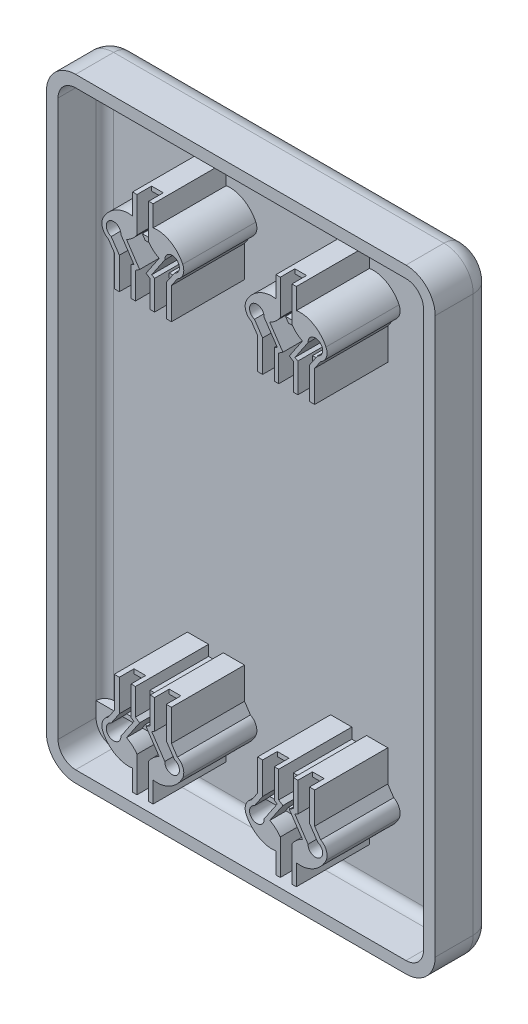
from build123d import *

# Parameters (mm, degrees)
SALIENTE_EXTRUIR1_DEPTH    = 20
REDONDEO1_R                = 7
VACIADO1_T                 = -4
CORTAR_EXTRUIR5_DEPTH      = 158.172679171
CORTAR_EXTRUIR5_DEPTH_BACK = 158.172679171
CROQUIS4_R                 = 1.6
CROQUIS4_19_R              = 3.5
CROQUIS4_19_R_2            = 1.6
CORTAR_EXTRUIR6_DEPTH      = 3
SALIENTE_EXTRUIR14_START   = 4
CROQUIS4_21_R              = 3.5
CROQUIS4_21_R_2            = 1.6
SALIENTE_EXTRUIR14_DEPTH   = 3
GUIA_START                 = 4
GUIA_CONTACTOS_DEPTH       = 25
ELEVADORES_START           = 4
CROQUIS5_23_W              = 4
CROQUIS5_23_H              = 1.504819616
CROQUIS5_23_W_2            = 5.046643545
CROQUIS5_23_H_2            = 1.498860913
CROQUIS5_23_H_3            = 1.502394155
CROQUIS5_23_H_4            = 1.495870233
CROQUIS5_23_H_5            = 1.495870234
CROQUIS5_23_H_6            = 1.502394154
CROQUIS5_23_H_7            = 1.498860914
ELEVADORES_DEPTH           = 20


with BuildPart() as part:
    # Croquis1 → Saliente-Extruir1 (new body)
    with BuildSketch(Plane.XY):
        with BuildLine():
            Line((-97.316636852, 96.923076923), (15.683363148, 96.923076923))
            ThreePointArc((15.683363148, 96.923076923), (22.75443096, 93.994144735), (25.683363148, 86.923076923))
            Line((25.683363148, 86.923076923), (25.683363148, -103.076923077))
            ThreePointArc((25.683363148, -103.076923077), (22.75443096, -110.147990889), (15.683363148, -113.076923077))
            Line((15.683363148, -113.076923077), (-97.316636852, -113.076923077))
            ThreePointArc((-97.316636852, -113.076923077), (-104.387704663, -110.147990889), (-107.316636852, -103.076923077))
            Line((-107.316636852, -103.076923077), (-107.316636852, 86.923076923))
            ThreePointArc((-107.316636852, 86.923076923), (-104.387704663, 93.994144735), (-97.316636852, 96.923076923))
        make_face()
    extrude(amount=SALIENTE_EXTRUIR1_DEPTH)

    # Redondeo1
    redondeo1_edges = [part.edges().sort_by_distance(p)[0] for p in [
        (-107.316636852, -8.076923077, 0),
        (-104.387704663, 93.994144735, 0),
        (-40.816636852, 96.923076923, 0),
        (22.75443096, 93.994144735, 0),
        (25.683363148, -8.076923077, 0),
        (22.75443096, -110.147990889, 0),
        (-40.816636852, -113.076923077, 0),
        (-104.387704663, -110.147990889, 0),
    ]]
    fillet(redondeo1_edges, radius=REDONDEO1_R)

    # Vaciado1
    vaciado1_openings = [part.faces().sort_by_distance(p)[0] for p in [
        (-40.816636852, -8.076923077, 20),
    ]]
    offset(amount=VACIADO1_T, openings=vaciado1_openings, kind=Kind.INTERSECTION)

    # Croquis4 (on Front Plane) → Cortar-Extruir5 (cut, two sides: drawn at the far end of the back side and taken through both)
    with BuildSketch(Plane.XY.offset(-CORTAR_EXTRUIR5_DEPTH_BACK)):
        with Locations(Location((-95.816636852, 85.423076923, 0), (0, 0, 180))):
            Circle(CROQUIS4_R)
        with Locations(Location((14.183363148, 85.423076923, 0), (0, 0, 180))):
            Circle(CROQUIS4_R)
        with Locations(Location((-95.816636852, -101.576923077, 0), (0, 0, 180))):
            Circle(CROQUIS4_R)
        with Locations(Location((14.183363148, -101.576923077, 0), (0, 0, 180))):
            Circle(CROQUIS4_R)
    extrude(amount=CORTAR_EXTRUIR5_DEPTH + CORTAR_EXTRUIR5_DEPTH_BACK, mode=Mode.SUBTRACT)

    # Croquis4<19> (on Front Plane) → Cortar-Extruir6 (cut)
    # profile 1 of 4: a face of its own
    with BuildSketch(Plane.XY):
        with Locations(Location((-95.816636852, 85.423076923, 0), (0, 0, 180))):
            Circle(CROQUIS4_19_R)
        with Locations(Location((-95.816636852, 85.423076923, 0), (0, 0, 180))):
            Circle(CROQUIS4_19_R_2, mode=Mode.SUBTRACT)
    # profile 2 of 4: a face of its own
    with BuildSketch(Plane.XY):
        with Locations(Location((14.183363148, 85.423076923, 0), (0, 0, 180))):
            Circle(CROQUIS4_19_R)
        with Locations(Location((14.183363148, 85.423076923, 0), (0, 0, 180))):
            Circle(CROQUIS4_19_R_2, mode=Mode.SUBTRACT)
    # profile 3 of 4: a face of its own
    with BuildSketch(Plane.XY):
        with Locations(Location((-95.816636852, -101.576923077, 0), (0, 0, 180))):
            Circle(CROQUIS4_19_R)
        with Locations(Location((-95.816636852, -101.576923077, 0), (0, 0, 180))):
            Circle(CROQUIS4_19_R_2, mode=Mode.SUBTRACT)
    # profile 4 of 4: a face of its own
    with BuildSketch(Plane.XY):
        with Locations(Location((14.183363148, -101.576923077, 0), (0, 0, 180))):
            Circle(CROQUIS4_19_R)
        with Locations(Location((14.183363148, -101.576923077, 0), (0, 0, 180))):
            Circle(CROQUIS4_19_R_2, mode=Mode.SUBTRACT)
    extrude(amount=CORTAR_EXTRUIR6_DEPTH, mode=Mode.SUBTRACT)

    # Croquis4<21> (on Front Plane) → Saliente-Extruir14 (add)
    # profile 1 of 8: a face of its own
    with BuildSketch(Plane.XY.offset(SALIENTE_EXTRUIR14_START)):
        with BuildLine():
            Line((-92.316636852, -109.076923077), (-92.316636852, -101.576923077))
            ThreePointArc((-92.316636852, -101.576923077), (-98.291510586, -104.051796811), (-95.816636852, -98.076923077))
            Line((-95.816636852, -98.076923077), (-103.316636852, -98.076923077))
            ThreePointArc((-103.316636852, -98.076923077), (-101.668986807, -107.429273032), (-92.316636852, -109.076923077))
        make_face()
    # profile 2 of 8: a face of its own
    with BuildSketch(Plane.XY.offset(SALIENTE_EXTRUIR14_START)):
        with Locations(Location((-95.816636852, -101.576923077, 0), (0, 0, 180))):
            Circle(CROQUIS4_21_R)
        with Locations(Location((-95.816636852, -101.576923077, 0), (0, 0, 180))):
            Circle(CROQUIS4_21_R_2, mode=Mode.SUBTRACT)
    # profile 3 of 8: a face of its own
    with BuildSketch(Plane.XY.offset(SALIENTE_EXTRUIR14_START)):
        with Locations(Location((14.183363148, -101.576923077, 0), (0, 0, 180))):
            Circle(CROQUIS4_21_R)
        with Locations(Location((14.183363148, -101.576923077, 0), (0, 0, 180))):
            Circle(CROQUIS4_21_R_2, mode=Mode.SUBTRACT)
    # profile 4 of 8: a face of its own
    with BuildSketch(Plane.XY.offset(SALIENTE_EXTRUIR14_START)):
        with BuildLine():
            ThreePointArc((17.683363148, -101.576923077), (14.183363148, -105.076923077), (10.683363148, -101.576923077))
            Line((10.683363148, -101.576923077), (10.683363148, -109.076923077))
            ThreePointArc((10.683363148, -109.076923077), (20.035713104, -107.429273032), (21.683363148, -98.076923077))
            Line((21.683363148, -98.076923077), (14.183363148, -98.076923077))
            ThreePointArc((14.183363148, -98.076923077), (16.658236883, -99.102049343), (17.683363148, -101.576923077))
        make_face()
    # profile 5 of 8: a face of its own
    with BuildSketch(Plane.XY.offset(SALIENTE_EXTRUIR14_START)):
        with BuildLine():
            ThreePointArc((17.683363148, 85.423076923), (16.658236883, 82.948203189), (14.183363148, 81.923076923))
            Line((14.183363148, 81.923076923), (21.683363148, 81.923076923))
            ThreePointArc((21.683363148, 81.923076923), (20.035713104, 91.275426878), (10.683363148, 92.923076923))
            Line((10.683363148, 92.923076923), (10.683363148, 85.423076923))
            ThreePointArc((10.683363148, 85.423076923), (14.183363148, 88.923076923), (17.683363148, 85.423076923))
        make_face()
    # profile 6 of 8: a face of its own
    with BuildSketch(Plane.XY.offset(SALIENTE_EXTRUIR14_START)):
        with BuildLine():
            Line((-103.316636852, 81.923076923), (-95.816636852, 81.923076923))
            ThreePointArc((-95.816636852, 81.923076923), (-98.291510586, 87.897950657), (-92.316636852, 85.423076923))
            Line((-92.316636852, 85.423076923), (-92.316636852, 92.923076923))
            ThreePointArc((-92.316636852, 92.923076923), (-101.668986807, 91.275426878), (-103.316636852, 81.923076923))
        make_face()
    # profile 7 of 8: a face of its own
    with BuildSketch(Plane.XY.offset(SALIENTE_EXTRUIR14_START)):
        with Locations(Location((-95.816636852, 85.423076923, 0), (0, 0, 180))):
            Circle(CROQUIS4_21_R)
        with Locations(Location((-95.816636852, 85.423076923, 0), (0, 0, 180))):
            Circle(CROQUIS4_21_R_2, mode=Mode.SUBTRACT)
    # profile 8 of 8: a face of its own
    with BuildSketch(Plane.XY.offset(SALIENTE_EXTRUIR14_START)):
        with Locations(Location((14.183363148, 85.423076923, 0), (0, 0, 180))):
            Circle(CROQUIS4_21_R)
        with Locations(Location((14.183363148, 85.423076923, 0), (0, 0, 180))):
            Circle(CROQUIS4_21_R_2, mode=Mode.SUBTRACT)
    extrude(amount=SALIENTE_EXTRUIR14_DEPTH)

    # Croquis5 → Guia contactos (add)
    with BuildSketch(Plane.XY.offset(GUIA_START)):
        with BuildLine():
            Line((-73.339958624, 59.826171884), (-76.135923142, 63.971359747))
            ThreePointArc((-76.135923142, 63.971359747), (-76.71461881, 68.405894657), (-72.819772852, 66.208131361))
            Line((-72.819772852, 66.208131361), (-68.346229624, 59.57583078))
            Line((-68.346229624, 59.57583078), (-69.339958624, 59.012970877))
            Line((-69.339958624, 59.012970877), (-69.339958624, 49.012651477))
            Line((-69.339958624, 49.012651477), (-67.839958624, 49.012651477))
            Line((-67.839958624, 49.012651477), (-67.839958624, 58.107987958))
            Line((-67.839958624, 58.107987958), (-66.416302227, 59.068256324))
            Line((-66.416302227, 59.068256324), (-70.898924286, 65.714016825))
            add(Edge.make_bspline(
                [(-67.316636852, 68.833301171), (-68.69376814, 66.819481242), (-70.898924286, 65.714016825)],
                knots=[0, 0, 0, 1, 1, 1], degree=2))
            Line((-67.316636852, 68.833301171), (-67.316636852, 80.83350237))
            Line((-67.316636852, 80.83350237), (-68.816636852, 80.83350237))
            Line((-68.816636852, 80.83350237), (-68.816636852, 73.678121554))
            add(Edge.make_bspline(
                [(-68.816636852, 73.678121554), (-72.988613334, 74.446263309), (-77.224394983, 71.676313296), (-78.960572842, 67.983067971)],
                knots=[0, 0, 0, 0, 1, 1, 1, 1], degree=3))
            ThreePointArc((-78.960572842, 67.983067971), (-79.091878576, 65.011351883), (-77.135395954, 62.770701653))
            Line((-77.135395954, 62.770701653), (-75.090185996, 59.738553197))
            Line((-75.090185996, 59.738553197), (-75.090185996, 49.012651477))
            Line((-75.090185996, 49.012651477), (-73.339958624, 49.012651477))
            Line((-73.339958624, 49.012651477), (-73.339958624, 59.826171884))
        make_face()
        with BuildLine():
            Line((-62.793315079, 58.107987958), (-62.793315079, 49.012651477))
            Line((-62.793315079, 49.012651477), (-61.293315079, 49.012651477))
            Line((-61.293315079, 49.012651477), (-61.293315079, 59.012970877))
            Line((-61.293315079, 59.012970877), (-62.287044079, 59.57583078))
            Line((-62.287044079, 59.57583078), (-57.813500852, 66.208131361))
            ThreePointArc((-57.813500852, 66.208131361), (-53.918654893, 68.405894657), (-54.497350561, 63.971359747))
            Line((-54.497350561, 63.971359747), (-57.293315079, 59.826171884))
            Line((-57.293315079, 59.826171884), (-57.293315079, 49.012651477))
            Line((-57.293315079, 49.012651477), (-55.543087707, 49.012651477))
            Line((-55.543087707, 49.012651477), (-55.543087707, 59.738553197))
            Line((-55.543087707, 59.738553197), (-53.497877749, 62.770701653))
            ThreePointArc((-53.497877749, 62.770701653), (-51.541395127, 65.011351883), (-51.672700861, 67.983067971))
            add(Edge.make_bspline(
                [(-61.816636852, 73.678121554), (-57.644660369, 74.446263309), (-53.40887872, 71.676313296), (-51.672700861, 67.983067971)],
                knots=[0, 0, 0, 0, 1, 1, 1, 1], degree=3))
            Line((-61.816636852, 73.678121554), (-61.816636852, 80.83350237))
            Line((-61.816636852, 80.83350237), (-63.316636852, 80.83350237))
            Line((-63.316636852, 80.83350237), (-63.316636852, 68.833301171))
            add(Edge.make_bspline(
                [(-63.316636852, 68.833301171), (-61.939505563, 66.819481242), (-59.734349417, 65.714016825)],
                knots=[0, 0, 0, 1, 1, 1], degree=2))
            Line((-59.734349417, 65.714016825), (-64.216971476, 59.068256324))
            Line((-64.216971476, 59.068256324), (-62.793315079, 58.107987958))
        make_face()
        with BuildLine():
            Line((-17.416302227, -75.222102477), (-18.839958624, -74.261834112))
            Line((-18.839958624, -74.261834112), (-18.839958624, -65.16649763))
            Line((-18.839958624, -65.16649763), (-20.339958624, -65.16649763))
            Line((-20.339958624, -65.16649763), (-20.339958624, -75.166817031))
            Line((-20.339958624, -75.166817031), (-19.346229624, -75.729676934))
            Line((-19.346229624, -75.729676934), (-23.819772852, -82.361977514))
            ThreePointArc((-23.819772852, -82.361977514), (-27.71461881, -84.559740811), (-27.135923142, -80.125205901))
            Line((-27.135923142, -80.125205901), (-24.339958624, -75.980018038))
            Line((-24.339958624, -75.980018038), (-24.339958624, -65.16649763))
            Line((-24.339958624, -65.16649763), (-26.090185996, -65.16649763))
            Line((-26.090185996, -65.16649763), (-26.090185996, -75.892399351))
            Line((-26.090185996, -75.892399351), (-28.135395954, -78.924547807))
            ThreePointArc((-28.135395954, -78.924547807), (-30.091878576, -81.165198036), (-29.960572842, -84.136914124))
            add(Edge.make_bspline(
                [(-19.816636852, -89.831967708), (-23.988613334, -90.600109463), (-28.224394983, -87.83015945), (-29.960572842, -84.136914124)],
                knots=[0, 0, 0, 0, 1, 1, 1, 1], degree=3))
            Line((-19.816636852, -89.831967708), (-19.816636852, -96.987348523))
            Line((-19.816636852, -96.987348523), (-18.316636852, -96.987348523))
            Line((-18.316636852, -96.987348523), (-18.316636852, -84.987147325))
            add(Edge.make_bspline(
                [(-18.316636852, -84.987147325), (-19.69376814, -82.973327396), (-21.898924286, -81.867862979)],
                knots=[0, 0, 0, 1, 1, 1], degree=2))
            Line((-21.898924286, -81.867862979), (-17.416302227, -75.222102477))
        make_face()
        with BuildLine():
            Line((-13.793315079, -65.16649763), (-13.793315079, -74.261834112))
            Line((-13.793315079, -74.261834112), (-15.216971476, -75.222102477))
            Line((-15.216971476, -75.222102477), (-10.734349417, -81.867862979))
            add(Edge.make_bspline(
                [(-14.316636852, -84.987147325), (-12.939505563, -82.973327396), (-10.734349417, -81.867862979)],
                knots=[0, 0, 0, 1, 1, 1], degree=2))
            Line((-14.316636852, -84.987147325), (-14.316636852, -96.987348523))
            Line((-14.316636852, -96.987348523), (-12.816636852, -96.987348523))
            Line((-12.816636852, -96.987348523), (-12.816636852, -89.831967708))
            add(Edge.make_bspline(
                [(-12.816636852, -89.831967708), (-8.644660369, -90.600109463), (-4.40887872, -87.83015945), (-2.672700861, -84.136914124)],
                knots=[0, 0, 0, 0, 1, 1, 1, 1], degree=3))
            ThreePointArc((-2.672700861, -84.136914124), (-2.541395127, -81.165198036), (-4.497877749, -78.924547807))
            Line((-4.497877749, -78.924547807), (-6.543087707, -75.892399351))
            Line((-6.543087707, -75.892399351), (-6.543087707, -65.16649763))
            Line((-6.543087707, -65.16649763), (-8.293315079, -65.16649763))
            Line((-8.293315079, -65.16649763), (-8.293315079, -75.980018038))
            Line((-8.293315079, -75.980018038), (-5.497350561, -80.125205901))
            ThreePointArc((-5.497350561, -80.125205901), (-4.918654893, -84.559740811), (-8.813500852, -82.361977514))
            Line((-8.813500852, -82.361977514), (-13.287044079, -75.729676934))
            Line((-13.287044079, -75.729676934), (-12.293315079, -75.166817031))
            Line((-12.293315079, -75.166817031), (-12.293315079, -65.16649763))
            Line((-12.293315079, -65.16649763), (-13.793315079, -65.16649763))
        make_face()
        with BuildLine():
            Line((-69.339958624, -65.16649763), (-69.339958624, -75.166817031))
            Line((-69.339958624, -75.166817031), (-68.346229624, -75.729676934))
            Line((-68.346229624, -75.729676934), (-72.819772852, -82.361977514))
            ThreePointArc((-72.819772852, -82.361977514), (-76.71461881, -84.559740811), (-76.135923142, -80.125205901))
            Line((-76.135923142, -80.125205901), (-73.339958624, -75.980018038))
            Line((-73.339958624, -75.980018038), (-73.339958624, -65.16649763))
            Line((-73.339958624, -65.16649763), (-75.090185996, -65.16649763))
            Line((-75.090185996, -65.16649763), (-75.090185996, -75.892399351))
            Line((-75.090185996, -75.892399351), (-77.135395954, -78.924547807))
            ThreePointArc((-77.135395954, -78.924547807), (-79.091878576, -81.165198036), (-78.960572842, -84.136914124))
            add(Edge.make_bspline(
                [(-68.816636852, -89.831967708), (-72.988613334, -90.600109463), (-77.224394983, -87.83015945), (-78.960572842, -84.136914124)],
                knots=[0, 0, 0, 0, 1, 1, 1, 1], degree=3))
            Line((-68.816636852, -89.831967708), (-68.816636852, -96.987348523))
            Line((-68.816636852, -96.987348523), (-67.316636852, -96.987348523))
            Line((-67.316636852, -96.987348523), (-67.316636852, -84.987147325))
            add(Edge.make_bspline(
                [(-67.316636852, -84.987147325), (-68.69376814, -82.973327396), (-70.898924286, -81.867862979)],
                knots=[0, 0, 0, 1, 1, 1], degree=2))
            Line((-70.898924286, -81.867862979), (-66.416302227, -75.222102477))
            Line((-66.416302227, -75.222102477), (-67.839958624, -74.261834112))
            Line((-67.839958624, -74.261834112), (-67.839958624, -65.16649763))
            Line((-67.839958624, -65.16649763), (-69.339958624, -65.16649763))
        make_face()
        with BuildLine():
            Line((-62.793315079, -65.16649763), (-62.793315079, -74.261834112))
            Line((-62.793315079, -74.261834112), (-64.216971476, -75.222102477))
            Line((-64.216971476, -75.222102477), (-59.734349417, -81.867862979))
            add(Edge.make_bspline(
                [(-63.316636852, -84.987147325), (-61.939505563, -82.973327396), (-59.734349417, -81.867862979)],
                knots=[0, 0, 0, 1, 1, 1], degree=2))
            Line((-63.316636852, -84.987147325), (-63.316636852, -96.987348523))
            Line((-63.316636852, -96.987348523), (-61.816636852, -96.987348523))
            Line((-61.816636852, -96.987348523), (-61.816636852, -89.831967708))
            add(Edge.make_bspline(
                [(-61.816636852, -89.831967708), (-57.644660369, -90.600109463), (-53.40887872, -87.83015945), (-51.672700861, -84.136914124)],
                knots=[0, 0, 0, 0, 1, 1, 1, 1], degree=3))
            ThreePointArc((-51.672700861, -84.136914124), (-51.541395127, -81.165198036), (-53.497877749, -78.924547807))
            Line((-53.497877749, -78.924547807), (-55.543087707, -75.892399351))
            Line((-55.543087707, -75.892399351), (-55.543087707, -65.16649763))
            Line((-55.543087707, -65.16649763), (-57.293315079, -65.16649763))
            Line((-57.293315079, -65.16649763), (-57.293315079, -75.980018038))
            Line((-57.293315079, -75.980018038), (-54.497350561, -80.125205901))
            ThreePointArc((-54.497350561, -80.125205901), (-53.918654893, -84.559740811), (-57.813500852, -82.361977514))
            Line((-57.813500852, -82.361977514), (-62.287044079, -75.729676934))
            Line((-62.287044079, -75.729676934), (-61.293315079, -75.166817031))
            Line((-61.293315079, -75.166817031), (-61.293315079, -65.16649763))
            Line((-61.293315079, -65.16649763), (-62.793315079, -65.16649763))
        make_face()
        with BuildLine():
            Line((-18.839958624, 49.012651477), (-18.839958624, 58.107987958))
            Line((-18.839958624, 58.107987958), (-17.416302227, 59.068256324))
            Line((-17.416302227, 59.068256324), (-21.898924286, 65.714016825))
            add(Edge.make_bspline(
                [(-18.316636852, 68.833301171), (-19.69376814, 66.819481242), (-21.898924286, 65.714016825)],
                knots=[0, 0, 0, 1, 1, 1], degree=2))
            Line((-18.316636852, 68.833301171), (-18.316636852, 80.83350237))
            Line((-18.316636852, 80.83350237), (-19.816636852, 80.83350237))
            Line((-19.816636852, 80.83350237), (-19.816636852, 73.678121554))
            add(Edge.make_bspline(
                [(-19.816636852, 73.678121554), (-23.988613334, 74.446263309), (-28.224394983, 71.676313296), (-29.960572842, 67.983067971)],
                knots=[0, 0, 0, 0, 1, 1, 1, 1], degree=3))
            ThreePointArc((-29.960572842, 67.983067971), (-30.091878576, 65.011351883), (-28.135395954, 62.770701653))
            Line((-28.135395954, 62.770701653), (-26.090185996, 59.738553197))
            Line((-26.090185996, 59.738553197), (-26.090185996, 49.012651477))
            Line((-26.090185996, 49.012651477), (-24.339958624, 49.012651477))
            Line((-24.339958624, 49.012651477), (-24.339958624, 59.826171884))
            Line((-24.339958624, 59.826171884), (-27.135923142, 63.971359747))
            ThreePointArc((-27.135923142, 63.971359747), (-27.71461881, 68.405894657), (-23.819772852, 66.208131361))
            Line((-23.819772852, 66.208131361), (-19.346229624, 59.57583078))
            Line((-19.346229624, 59.57583078), (-20.339958624, 59.012970877))
            Line((-20.339958624, 59.012970877), (-20.339958624, 49.012651477))
            Line((-20.339958624, 49.012651477), (-18.839958624, 49.012651477))
        make_face()
        with BuildLine():
            Line((-13.793315079, 58.107987958), (-13.793315079, 49.012651477))
            Line((-13.793315079, 49.012651477), (-12.293315079, 49.012651477))
            Line((-12.293315079, 49.012651477), (-12.293315079, 59.012970877))
            Line((-12.293315079, 59.012970877), (-13.287044079, 59.57583078))
            Line((-13.287044079, 59.57583078), (-8.813500852, 66.208131361))
            ThreePointArc((-8.813500852, 66.208131361), (-4.918654893, 68.405894657), (-5.497350561, 63.971359747))
            Line((-5.497350561, 63.971359747), (-8.293315079, 59.826171884))
            Line((-8.293315079, 59.826171884), (-8.293315079, 49.012651477))
            Line((-8.293315079, 49.012651477), (-6.543087707, 49.012651477))
            Line((-6.543087707, 49.012651477), (-6.543087707, 59.738553197))
            Line((-6.543087707, 59.738553197), (-4.497877749, 62.770701653))
            ThreePointArc((-4.497877749, 62.770701653), (-2.541395127, 65.011351883), (-2.672700861, 67.983067971))
            add(Edge.make_bspline(
                [(-12.816636852, 73.678121554), (-8.644660369, 74.446263309), (-4.40887872, 71.676313296), (-2.672700861, 67.983067971)],
                knots=[0, 0, 0, 0, 1, 1, 1, 1], degree=3))
            Line((-12.816636852, 73.678121554), (-12.816636852, 80.83350237))
            Line((-12.816636852, 80.83350237), (-14.316636852, 80.83350237))
            Line((-14.316636852, 80.83350237), (-14.316636852, 68.833301171))
            add(Edge.make_bspline(
                [(-14.316636852, 68.833301171), (-12.939505563, 66.819481242), (-10.734349417, 65.714016825)],
                knots=[0, 0, 0, 1, 1, 1], degree=2))
            Line((-10.734349417, 65.714016825), (-15.216971476, 59.068256324))
            Line((-15.216971476, 59.068256324), (-13.793315079, 58.107987958))
        make_face()
    extrude(amount=GUIA_CONTACTOS_DEPTH)

    # Croquis5<23> → Elevadores (add)
    with BuildSketch(Plane.XY.offset(ELEVADORES_START)):
        Polygon((-61.137067805, -79.788247448), (-69.496205898, -79.788247448), (-70.507539793, -81.287611605), (-60.12573391, -81.287611605), align=None)
        with BuildLine():
            Line((-72.095103896, -81.287611605), (-71.083770001, -79.788247448))
            Line((-71.083770001, -79.788247448), (-75.908641795, -79.788247448))
            Line((-75.908641795, -79.788247448), (-76.135923142, -80.125205901))
            ThreePointArc((-76.135923142, -80.125205901), (-76.93122765, -80.57845828), (-77.510061428, -81.287611605))
            Line((-77.510061428, -81.287611605), (-72.095103896, -81.287611605))
        make_face()
        with Locations((-71.339958624, -73.509424304)):
            Rectangle(CROQUIS5_23_W, CROQUIS5_23_H)
        with Locations((-65.316636852, -69.516906653)):
            Rectangle(CROQUIS5_23_W_2, CROQUIS5_23_H_2)
        with Locations((-71.339958624, -65.917694708)):
            Rectangle(CROQUIS5_23_W, CROQUIS5_23_H_3)
        with Locations((-59.293315079, -65.917694708)):
            Rectangle(CROQUIS5_23_W, CROQUIS5_23_H_3)
        with Locations((-59.293315079, -73.509424304)):
            Rectangle(CROQUIS5_23_W, CROQUIS5_23_H)
        with BuildLine():
            Line((-54.724631908, -79.788247448), (-59.549503702, -79.788247448))
            Line((-59.549503702, -79.788247448), (-58.538169807, -81.287611605))
            Line((-58.538169807, -81.287611605), (-53.123212275, -81.287611605))
            ThreePointArc((-53.123212275, -81.287611605), (-53.702046053, -80.57845828), (-54.497350561, -80.125205901))
            Line((-54.497350561, -80.125205901), (-54.724631908, -79.788247448))
        make_face()
        with Locations((-22.339958624, -65.917694708)):
            Rectangle(CROQUIS5_23_W, CROQUIS5_23_H_3)
        with Locations((-16.316636852, -69.516906653)):
            Rectangle(CROQUIS5_23_W_2, CROQUIS5_23_H_2)
        with Locations((-10.293315079, -65.917694708)):
            Rectangle(CROQUIS5_23_W, CROQUIS5_23_H_3)
        with Locations((-22.339958624, -73.509424304)):
            Rectangle(CROQUIS5_23_W, CROQUIS5_23_H)
        with BuildLine():
            Line((-23.095103896, -81.287611605), (-22.083770001, -79.788247448))
            Line((-22.083770001, -79.788247448), (-26.908641795, -79.788247448))
            Line((-26.908641795, -79.788247448), (-27.135923142, -80.125205901))
            ThreePointArc((-27.135923142, -80.125205901), (-27.93122765, -80.57845828), (-28.510061428, -81.287611605))
            Line((-28.510061428, -81.287611605), (-23.095103896, -81.287611605))
        make_face()
        Polygon((-12.137067805, -79.788247448), (-20.496205898, -79.788247448), (-21.507539793, -81.287611605), (-11.12573391, -81.287611605), align=None)
        with BuildLine():
            Line((-5.724631908, -79.788247448), (-10.549503702, -79.788247448))
            Line((-10.549503702, -79.788247448), (-9.538169807, -81.287611605))
            Line((-9.538169807, -81.287611605), (-4.123212275, -81.287611605))
            ThreePointArc((-4.123212275, -81.287611605), (-4.702046053, -80.57845828), (-5.497350561, -80.125205901))
            Line((-5.497350561, -80.125205901), (-5.724631908, -79.788247448))
        make_face()
        with Locations((-16.316636852, -96.239413407)):
            Rectangle(CROQUIS5_23_W, CROQUIS5_23_H_4)
        with Locations((-65.316636852, -96.239413407)):
            Rectangle(CROQUIS5_23_W, CROQUIS5_23_H_4)
        with Locations((-65.316636852, 80.085567253)):
            Rectangle(CROQUIS5_23_W, CROQUIS5_23_H_5)
        Polygon((-70.507539793, 65.133765452), (-69.496205898, 63.634401294), (-61.137067805, 63.634401294), (-60.12573391, 65.133765452), align=None)
        with BuildLine():
            Line((-58.538169807, 65.133765452), (-59.549503702, 63.634401294))
            Line((-59.549503702, 63.634401294), (-54.724631908, 63.634401294))
            Line((-54.724631908, 63.634401294), (-54.497350561, 63.971359747))
            ThreePointArc((-54.497350561, 63.971359747), (-53.702046053, 64.424612126), (-53.123212275, 65.133765452))
            Line((-53.123212275, 65.133765452), (-58.538169807, 65.133765452))
        make_face()
        with Locations((-59.293315079, 57.35557815)):
            Rectangle(CROQUIS5_23_W, CROQUIS5_23_H)
        with Locations((-59.293315079, 49.763848554)):
            Rectangle(CROQUIS5_23_W, CROQUIS5_23_H_6)
        with Locations((-65.316636852, 53.363060499)):
            Rectangle(CROQUIS5_23_W_2, CROQUIS5_23_H_7)
        with Locations((-71.339958624, 49.763848554)):
            Rectangle(CROQUIS5_23_W, CROQUIS5_23_H_6)
        with Locations((-71.339958624, 57.35557815)):
            Rectangle(CROQUIS5_23_W, CROQUIS5_23_H)
        with BuildLine():
            Line((-76.135923142, 63.971359747), (-75.908641795, 63.634401294))
            Line((-75.908641795, 63.634401294), (-71.083770001, 63.634401294))
            Line((-71.083770001, 63.634401294), (-72.095103896, 65.133765452))
            Line((-72.095103896, 65.133765452), (-77.510061428, 65.133765452))
            ThreePointArc((-77.510061428, 65.133765452), (-76.93122765, 64.424612126), (-76.135923142, 63.971359747))
        make_face()
        Polygon((-21.507539793, 65.133765452), (-20.496205898, 63.634401294), (-12.137067805, 63.634401294), (-11.12573391, 65.133765452), align=None)
        with Locations((-22.339958624, 57.35557815)):
            Rectangle(CROQUIS5_23_W, CROQUIS5_23_H)
        with BuildLine():
            Line((-27.135923142, 63.971359747), (-26.908641795, 63.634401294))
            Line((-26.908641795, 63.634401294), (-22.083770001, 63.634401294))
            Line((-22.083770001, 63.634401294), (-23.095103896, 65.133765452))
            Line((-23.095103896, 65.133765452), (-28.510061428, 65.133765452))
            ThreePointArc((-28.510061428, 65.133765452), (-27.93122765, 64.424612126), (-27.135923142, 63.971359747))
        make_face()
        with Locations((-16.316636852, 80.085567253)):
            Rectangle(CROQUIS5_23_W, CROQUIS5_23_H_5)
        with BuildLine():
            Line((-10.549503702, 63.634401294), (-5.724631908, 63.634401294))
            Line((-5.724631908, 63.634401294), (-5.497350561, 63.971359747))
            ThreePointArc((-5.497350561, 63.971359747), (-4.702046053, 64.424612126), (-4.123212275, 65.133765452))
            Line((-4.123212275, 65.133765452), (-9.538169807, 65.133765452))
            Line((-9.538169807, 65.133765452), (-10.549503702, 63.634401294))
        make_face()
        with Locations((-10.293315079, 57.35557815)):
            Rectangle(CROQUIS5_23_W, CROQUIS5_23_H)
        with Locations((-10.293315079, 49.763848554)):
            Rectangle(CROQUIS5_23_W, CROQUIS5_23_H_6)
        with Locations((-22.339958624, 49.763848554)):
            Rectangle(CROQUIS5_23_W, CROQUIS5_23_H_6)
        with Locations((-16.316636852, 53.363060499)):
            Rectangle(CROQUIS5_23_W_2, CROQUIS5_23_H_7)
        with Locations((-10.293315079, -73.509424304)):
            Rectangle(CROQUIS5_23_W, CROQUIS5_23_H)
    extrude(amount=ELEVADORES_DEPTH)


solid = part.part
